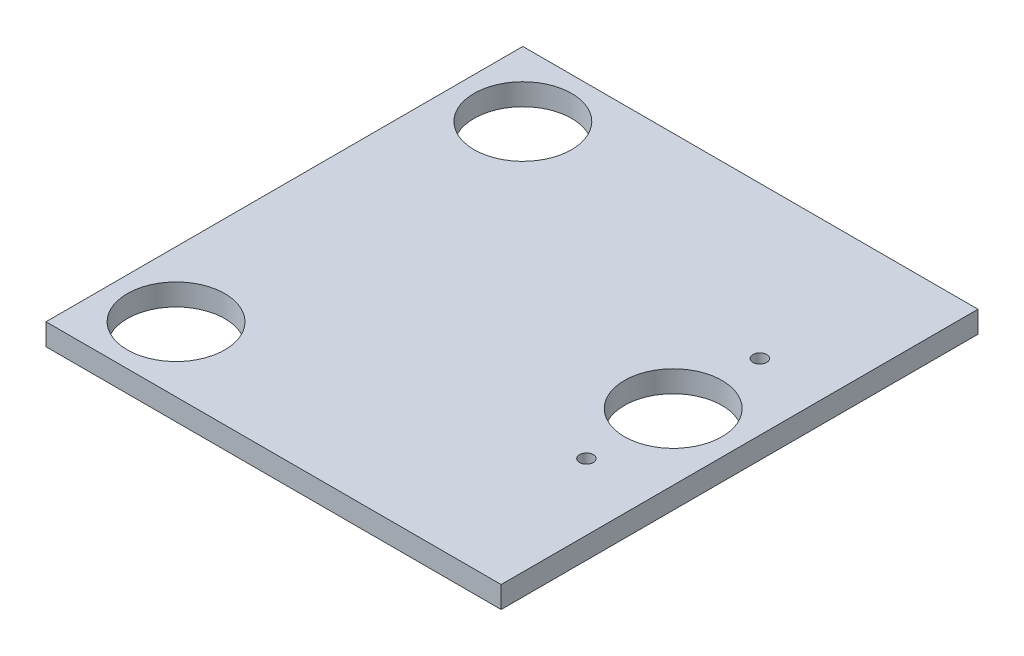
from build123d import *

# Parameters (mm, degrees)
SKETCH1_W           = 133.35
SKETCH1_H           = 139.7
SKETCH1_R           = 2.0193
BOSS_EXTRUDE1_DEPTH = 6.35
SKETCH2_R           = 14.2875
CUT_EXTRUDE1_DEPTH  = 151.670393575


with BuildPart() as part:
    # Sketch1 → Boss-Extrude1 (new body)
    with BuildSketch(Plane(origin=(0, 0, 0), x_dir=(1, 0, 0), z_dir=(0, 1, 0))):
        with Locations((66.675, 0)):
            Rectangle(SKETCH1_W, SKETCH1_H)
        with Locations((113.883981674, 25.395517123)):
            Circle(SKETCH1_R, mode=Mode.SUBTRACT)
        with Locations((113.883981674, -25.404482877)):
            Circle(SKETCH1_R, mode=Mode.SUBTRACT)
    extrude(amount=BOSS_EXTRUDE1_DEPTH)

    # Sketch2 → Cut-Extrude1 (cut, through all)
    with BuildSketch(Plane(origin=(0, 0, 0), x_dir=(1, 0, 0), z_dir=(0, 1, 0))):
        with Locations((19.05, 50.8)):
            Circle(SKETCH2_R)
        with Locations((19.05, -50.8)):
            Circle(SKETCH2_R)
        with Locations((113.900712, 0)):
            Circle(SKETCH2_R)
    extrude(amount=CUT_EXTRUDE1_DEPTH, mode=Mode.SUBTRACT)


solid = part.part
